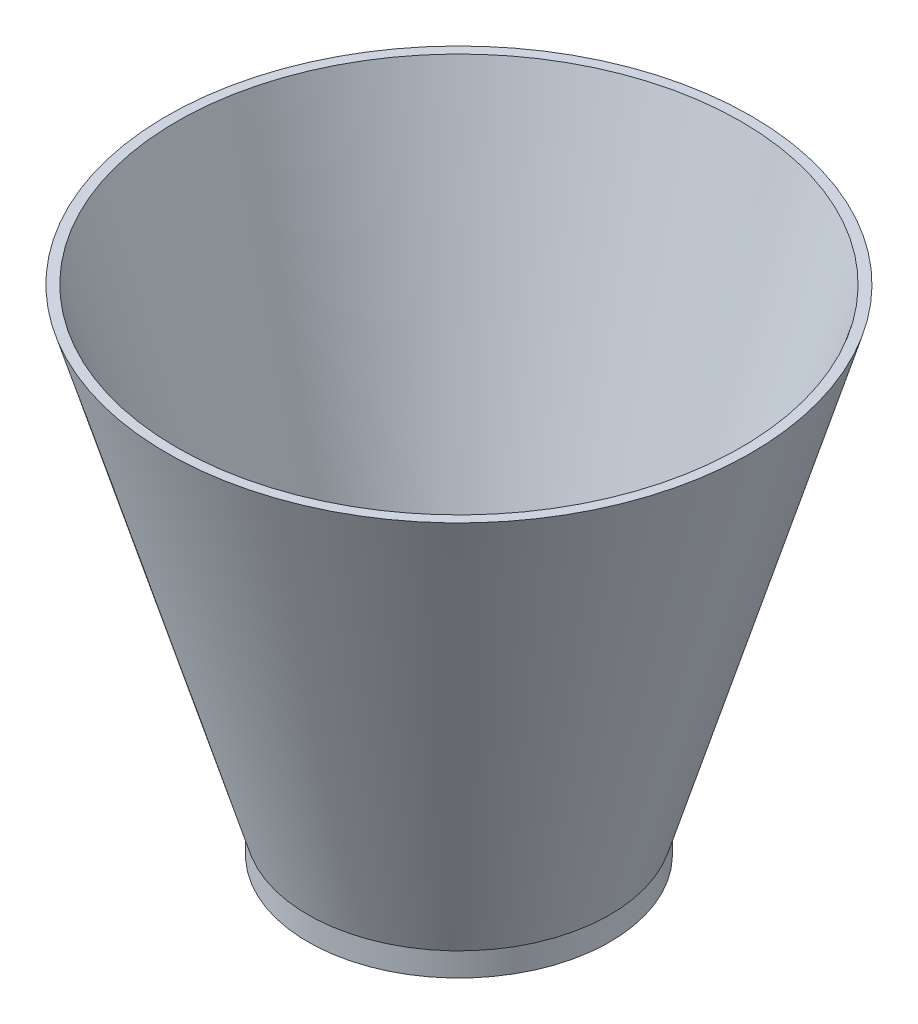
from build123d import *

# Parameters (mm, degrees)
SKETCH2_R           = 32.088061302
SKETCH2_R_2         = 30
BOSS_EXTRUDE1_DEPTH = 5


with BuildPart() as part:
    # Sketch1 → Revolve1 (revolve)
    with BuildSketch(Plane.XY):
        Polygon((-30, 0), (-60, 100), (-62.088061302, 100), (-32.088061302, 0), align=None)
    revolve(axis=Axis((0, 0, 0), (0, 1, 0)))

    # Sketch2 → Boss-Extrude1 (add)
    with BuildSketch(Plane.XZ):
        Circle(SKETCH2_R)
        Circle(SKETCH2_R_2, mode=Mode.SUBTRACT)
    extrude(amount=BOSS_EXTRUDE1_DEPTH)


solid = part.part
